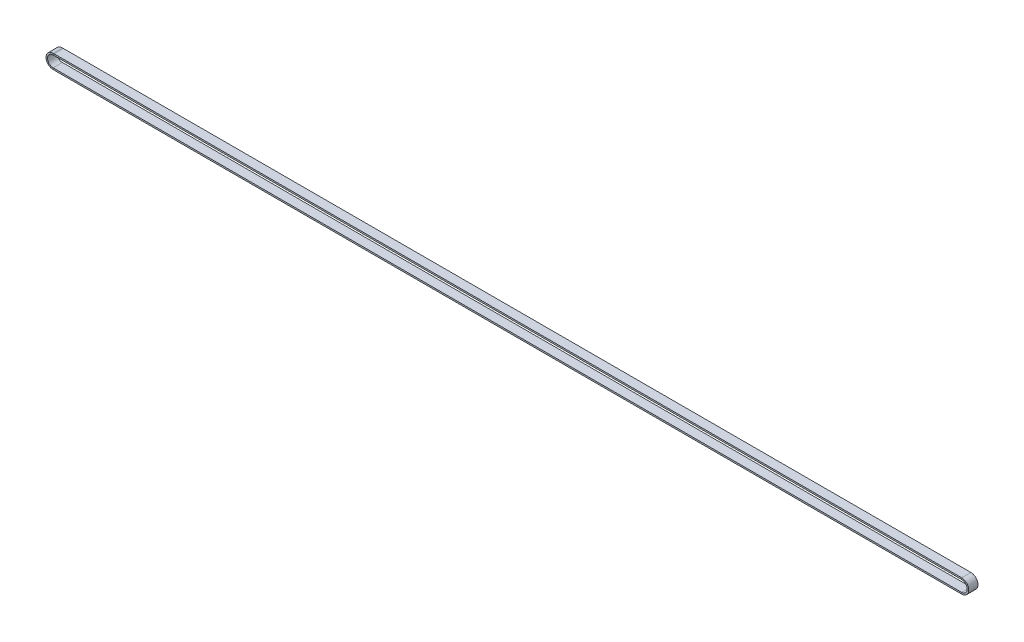
from build123d import *

# Parameters (mm, degrees)
SKETCH3_W = 9
SKETCH3_H = 1.5


with BuildPart() as part:
    # Sweep1: sweep along a path in Sketch2
    with BuildLine(Plane.XY) as sweep1_path:
        Line((-1, -26.8899768), (883.52063792, -26.8899768))
        ThreePointArc((883.52063792, -26.8899768), (890.42063792, -33.7899768), (883.52063792, -40.6899768))
        Line((883.52063792, -40.6899768), (-1, -40.6899768))
        ThreePointArc((-1, -40.6899768), (-7.9, -33.7899768), (-1, -26.8899768))
    # Sketch3 → Sweep1 (sweep)
    with BuildSketch(Plane(origin=(0, 0, 0), x_dir=(0, 0, -1), z_dir=(1, 0, 0))):
        with Locations((-4.5, -27.6399768)):
            Rectangle(SKETCH3_W, SKETCH3_H)
    sweep(path=sweep1_path.line)


solid = part.part
